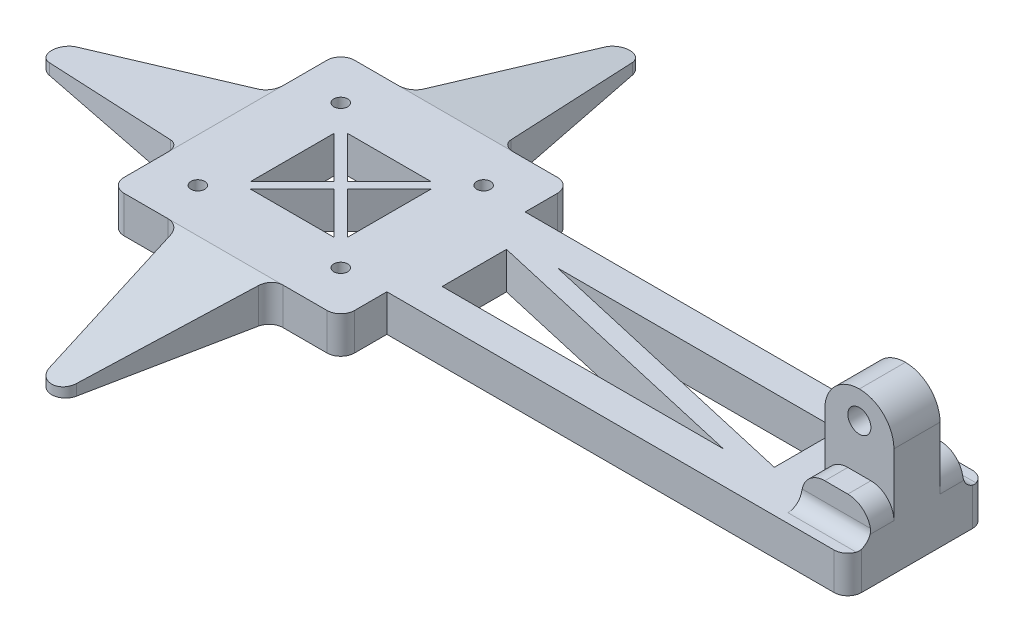
from build123d import *

# Parameters (mm, degrees)
BOSS_EXTRUDE1_DEPTH     = 8
FILLET1_R               = 3
CUT_EXTRUDE1_DEPTH      = 90.03548582
CUT_EXTRUDE2_DEPTH      = 90.03548582
CUT_EXTRUDE2_DEPTH_BACK = 90.03548582
FILLET2_R               = 3
SKETCH4_R               = 1.5
CUT_EXTRUDE3_DEPTH      = 90.03548582
SKETCH5_R               = 2.5
CUT_EXTRUDE4_DEPTH      = 3
SKETCH7_W               = 100
SKETCH7_H               = 30
BOSS_EXTRUDE2_DEPTH     = 8
SKETCH8_W               = 15
SKETCH8_H               = 20
BOSS_EXTRUDE3_DEPTH     = 23
SKETCH9_R               = 2.5
CUT_EXTRUDE5_DEPTH      = 20
FILLET3_R               = 7.5
FILLET4_R               = 3
FILLET5_R               = 3
CUT_EXTRUDE6_DEPTH      = 142.723882577
CUT_EXTRUDE7_DEPTH      = 5
SKETCH12_W              = 15
SKETCH12_H              = 6
CUT_EXTRUDE8_DEPTH      = 5
SKETCH13_W              = 15
SKETCH13_H              = 6
CUT_EXTRUDE9_DEPTH      = 5
FILLET6_R               = 5


with BuildPart() as part:
    # Sketch1 → Boss-Extrude1 (new body)
    with BuildSketch(Plane(origin=(0, 0, 0), x_dir=(1, 0, 0), z_dir=(0, 1, 0))):
        Polygon((-10, 25), (0, 75), (10, 25), (25, 25), (25, 10), (75, 0), (25, -10), (25, -25), (10, -25), (0, -75), (-10, -25), (-25, -25), (-25, -10), (-75, 0), (-25, 10), (-25, 25), align=None)
    extrude(amount=BOSS_EXTRUDE1_DEPTH)

    # Fillet1
    fillet1_edges = [part.edges().sort_by_distance(p)[0] for p in [
        (0, 4, -75),
        (75, 4, 0),
        (0, 4, 75),
        (-75, 4, 0),
    ]]
    fillet(fillet1_edges, radius=FILLET1_R)

    # Sketch2 → Cut-Extrude1 (cut, symmetric)
    with BuildSketch(Plane(origin=(0, 0, 0), x_dir=(0, 0, -1), z_dir=(1, 0, 0))):
        Polygon((25, 8), (62.702941459, 2), (62.702941459, 8), align=None)
    cut_extrude1 = extrude(amount=CUT_EXTRUDE1_DEPTH, both=True, mode=Mode.SUBTRACT)

    # Mirror2: Cut-Extrude1 across plane
    add(cut_extrude1.mirror(Plane.XY), mode=Mode.SUBTRACT)

    # Sketch3 → Cut-Extrude2 (cut, two sides: drawn at the far end of the back side and taken through both)
    with BuildSketch(Plane.XY.offset(-CUT_EXTRUDE2_DEPTH_BACK)):
        Polygon((-25, 8), (-62.702941459, 2), (-62.702941459, 8), align=None)
    extrude(amount=CUT_EXTRUDE2_DEPTH + CUT_EXTRUDE2_DEPTH_BACK, mode=Mode.SUBTRACT)

    # Fillet2
    fillet2_edges = [part.edges().sort_by_distance(p)[0] for p in [
        (-10, 4, -25),
        (10, 4, -25),
        (25, 4, -25),
        (25, 4, 25),
        (10, 4, 25),
        (-10, 4, 25),
        (-25, 4, 25),
        (-25, 4, 10),
        (-25, 4, -10),
        (-25, 4, -25),
    ]]
    fillet(fillet2_edges, radius=FILLET2_R)

    # Sketch4 → Cut-Extrude3 (cut, through all)
    with BuildSketch(Plane(origin=(0, 8, 0), x_dir=(1, 0, 0), z_dir=(0, 1, 0))):
        with Locations(Location((-15.5, 15.5, 0), (0, 0, 270))):
            Circle(SKETCH4_R)
        with Locations(Location((15.5, 15.5, 0), (0, 0, 270))):
            Circle(SKETCH4_R)
        with Locations(Location((15.5, -15.5, 0), (0, 0, 270))):
            Circle(SKETCH4_R)
        with Locations(Location((-15.5, -15.5, 0), (0, 0, 270))):
            Circle(SKETCH4_R)
    extrude(amount=-CUT_EXTRUDE3_DEPTH, mode=Mode.SUBTRACT)

    # Sketch5 → Cut-Extrude4 (cut)
    with BuildSketch(Plane.XZ):
        with Locations(Location((15.5, -15.5, 0), (0, 0, 270))):
            Circle(SKETCH5_R)
        with Locations(Location((-15.5, -15.5, 0), (0, 0, 270))):
            Circle(SKETCH5_R)
        with Locations(Location((-15.5, 15.5, 0), (0, 0, 270))):
            Circle(SKETCH5_R)
        with Locations(Location((15.5, 15.5, 0), (0, 0, 270))):
            Circle(SKETCH5_R)
    extrude(amount=-CUT_EXTRUDE4_DEPTH, mode=Mode.SUBTRACT)

    # Sketch7 → Boss-Extrude2 (add)
    with BuildSketch(Plane(origin=(0, 8, 0), x_dir=(1, 0, 0), z_dir=(0, 1, 0))):
        with Locations((75, 0)):
            Rectangle(SKETCH7_W, SKETCH7_H)
    extrude(amount=-BOSS_EXTRUDE2_DEPTH)

    # Sketch8 → Boss-Extrude3 (add)
    with BuildSketch(Plane(origin=(0, 8, 0), x_dir=(1, 0, 0), z_dir=(0, 1, 0))):
        with Locations((117.5, 0)):
            Rectangle(SKETCH8_W, SKETCH8_H)
    extrude(amount=BOSS_EXTRUDE3_DEPTH)

    # Sketch9 → Cut-Extrude5 (cut)
    with BuildSketch(Plane.XY.offset(10)):
        with Locations((117.5, 25)):
            Circle(SKETCH9_R)
    extrude(amount=-CUT_EXTRUDE5_DEPTH, mode=Mode.SUBTRACT)

    # Fillet3
    fillet3_edges = [part.edges().sort_by_distance(p)[0] for p in [
        (110, 31, 0),
        (125, 31, 0),
    ]]
    fillet(fillet3_edges, radius=FILLET3_R - 0.0001)  # a hair under: the kernel refuses the full size

    # Fillet4
    fillet4_edges = [part.edges().sort_by_distance(p)[0] for p in [
        (117.5, 8, -10),
        (117.5, 8, 10),
    ]]
    fillet(fillet4_edges, radius=FILLET4_R)

    # Fillet5
    fillet5_edges = [part.edges().sort_by_distance(p)[0] for p in [
        (125, 4, 15),
        (125, 4, -15),
    ]]
    fillet(fillet5_edges, radius=FILLET5_R)

    # Sketch10 → Cut-Extrude6 (cut, through all)
    with BuildSketch(Plane(origin=(0, 8, 0), x_dir=(1, 0, 0), z_dir=(0, 1, 0))):
        Polygon((30, -8), (91.024338464, -8), (30, 5.94842022), align=None)
        Polygon((38.975661536, 8), (100, 8), (100, -5.94842022), align=None)
        Polygon((9.085786438, 10.5), (0, 1.414213562), (-9.085786438, 10.5), align=None)
        Polygon((10.5, -9.085786438), (1.414213562, 0), (10.5, 9.085786438), align=None)
        Polygon((-9.085786438, -10.5), (0, -1.414213562), (9.085786438, -10.5), align=None)
        Polygon((-10.5, 9.085786438), (-1.414213562, 0), (-10.5, -9.085786438), align=None)
    extrude(amount=-CUT_EXTRUDE6_DEPTH, mode=Mode.SUBTRACT)

    # Sketch11 → Cut-Extrude7 (cut)
    with BuildSketch(Plane.XY.offset(10)):
        with BuildLine():
            Line((109, 25), (109, 32))
            Line((109, 32), (126, 32))
            Line((126, 32), (126, 25))
            ThreePointArc((126, 25), (117.5, 16.5), (109, 25))
        make_face()
    cut_extrude7 = extrude(amount=-CUT_EXTRUDE7_DEPTH, mode=Mode.SUBTRACT)

    # Mirror4: Cut-Extrude7 across plane
    add(cut_extrude7.mirror(Plane.XY), mode=Mode.SUBTRACT)

    # Sketch12 → Cut-Extrude8 (cut)
    with BuildSketch(Plane.XY.offset(10)):
        with Locations((117.5, 18)):
            Rectangle(SKETCH12_W, SKETCH12_H)
    extrude(amount=-CUT_EXTRUDE8_DEPTH, mode=Mode.SUBTRACT)

    # Sketch13 → Cut-Extrude9 (cut)
    with BuildSketch(Plane(origin=(0, 0, -10), x_dir=(-1, 0, 0), z_dir=(0, 0, -1))):
        with Locations((-117.5, 18)):
            Rectangle(SKETCH13_W, SKETCH13_H)
    extrude(amount=-CUT_EXTRUDE9_DEPTH, mode=Mode.SUBTRACT)

    # Fillet6
    fillet6_edges = [part.edges().sort_by_distance(p)[0] for p in [
        (125, 15, -7.5),
        (110, 15, -7.5),
        (110, 15, 7.5),
        (125, 15, 7.5),
    ]]
    fillet(fillet6_edges, radius=FILLET6_R)


solid = part.part
